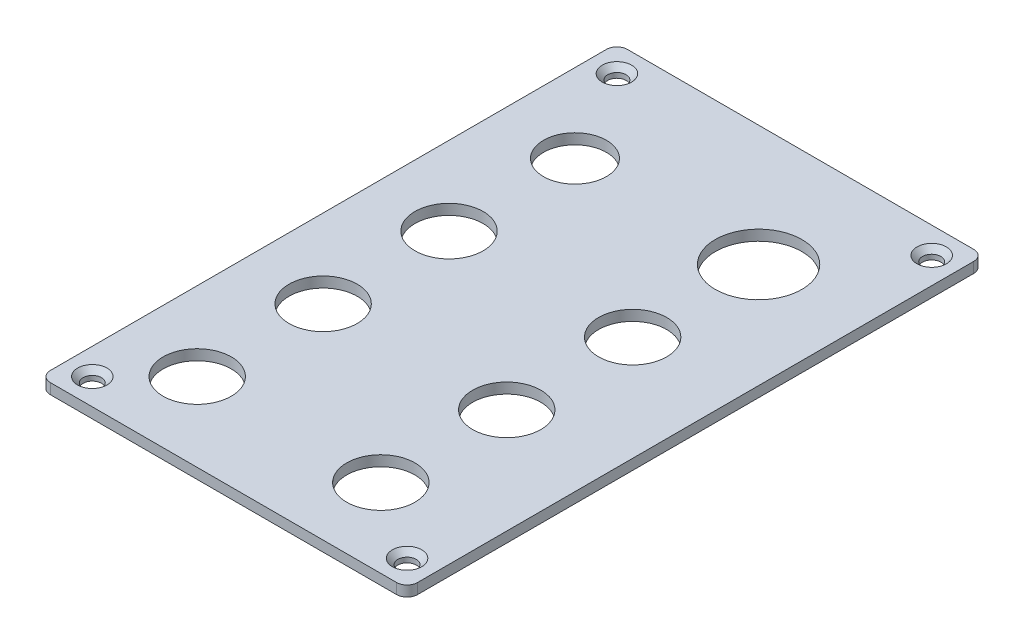
from build123d import *

# Parameters (mm, degrees)
FACE_PLATE_W           = 70
FACE_PLATE_H           = 110
FACE_PLATE_EXT_DEPTH   = 2
BUTTONS_R              = 6
BUTTONS_R_2            = 8.25
BUTTONS_R_3            = 6.5
BUTTONS_CUT_DEPTH      = 10
M3_TOP_SCREW_R         = 1.75
M3_TOP_SCREW_CUT_DEPTH = 10
FILLET1_R              = 2
FILLET2_R              = 2
FILLET3_R              = 2
FILLET4_R              = 2


with BuildPart() as part:
    # Face Plate → Face Plate Ext (new body)
    with BuildSketch(Plane(origin=(0, 0, 0), x_dir=(1, 0, 0), z_dir=(0, 1, 0))):
        Rectangle(FACE_PLATE_W, FACE_PLATE_H)
    extrude(amount=FACE_PLATE_EXT_DEPTH)

    # Buttons → Buttons CUT (cut)
    with BuildSketch(Plane(origin=(0, 2, 0), x_dir=(1, 0, 0), z_dir=(0, 1, 0))):
        with Locations((-20, 32)):
            Circle(BUTTONS_R)
        with Locations((15, 32)):
            Circle(BUTTONS_R_2)
        with Locations((-20, 8)):
            Circle(BUTTONS_R_3)
        with Locations((15, 8)):
            Circle(BUTTONS_R_3)
        with Locations((-20, -16)):
            Circle(BUTTONS_R_3)
        with Locations((-20, -40)):
            Circle(BUTTONS_R_3)
        with Locations((15, -16)):
            Circle(BUTTONS_R_3)
        with Locations((15, -40)):
            Circle(BUTTONS_R_3)
    extrude(amount=-BUTTONS_CUT_DEPTH, mode=Mode.SUBTRACT)

    # M3 Top Screw → M3 Top Screw CUT (cut)
    with BuildSketch(Plane(origin=(0, 2, 0), x_dir=(1, 0, 0), z_dir=(0, 1, 0))):
        with Locations((-30, 50)):
            Circle(M3_TOP_SCREW_R)
        with Locations((30, 50)):
            Circle(M3_TOP_SCREW_R)
        with Locations((-30, -50)):
            Circle(M3_TOP_SCREW_R)
        with Locations((30, -50)):
            Circle(M3_TOP_SCREW_R)
    extrude(amount=-M3_TOP_SCREW_CUT_DEPTH, mode=Mode.SUBTRACT)

    # M3 Head Top CUT cone 1 section (through the dimple's axis) → M3 Head Top CUT (revolve, cut)
    with BuildSketch(Plane(origin=(-30, 2, -50), x_dir=(0, 0, 1), z_dir=(1, 0, 0))):
        Polygon((0, 0), (2.8, 0), (0, 2.8), align=None)
    revolve(axis=Axis((-30, 2, -50), (0, -1, 0)), mode=Mode.SUBTRACT)

    # M3 Head Top CUT cone 2 section (through the dimple's axis) → M3 Head Top CUT cone 2 (revolve, cut)
    with BuildSketch(Plane(origin=(30, 2, -50), x_dir=(0, 0, 1), z_dir=(1, 0, 0))):
        Polygon((0, 0), (2.8, 0), (0, 2.8), align=None)
    revolve(axis=Axis((30, 2, -50), (0, -1, 0)), mode=Mode.SUBTRACT)

    # M3 Head Top CUT cone 3 section (through the dimple's axis) → M3 Head Top CUT cone 3 (revolve, cut)
    with BuildSketch(Plane(origin=(30, 2, 50), x_dir=(0, 0, 1), z_dir=(1, 0, 0))):
        Polygon((0, 0), (2.8, 0), (0, 2.8), align=None)
    revolve(axis=Axis((30, 2, 50), (0, -1, 0)), mode=Mode.SUBTRACT)

    # M3 Head Top CUT cone 4 section (through the dimple's axis) → M3 Head Top CUT cone 4 (revolve, cut)
    with BuildSketch(Plane(origin=(-30, 2, 50), x_dir=(0, 0, 1), z_dir=(1, 0, 0))):
        Polygon((0, 0), (2.8, 0), (0, 2.8), align=None)
    revolve(axis=Axis((-30, 2, 50), (0, -1, 0)), mode=Mode.SUBTRACT)

    # Fillet1
    fillet1_edges = [part.edges().sort_by_distance(p)[0] for p in [
        (-35, 1, -55),
    ]]
    fillet(fillet1_edges, radius=FILLET1_R)

    # Fillet2
    fillet2_edges = [part.edges().sort_by_distance(p)[0] for p in [
        (35, 1, -55),
    ]]
    fillet(fillet2_edges, radius=FILLET2_R)

    # Fillet3
    fillet3_edges = [part.edges().sort_by_distance(p)[0] for p in [
        (35, 1, 55),
    ]]
    fillet(fillet3_edges, radius=FILLET3_R)

    # Fillet4
    fillet4_edges = [part.edges().sort_by_distance(p)[0] for p in [
        (-35, 1, 55),
    ]]
    fillet(fillet4_edges, radius=FILLET4_R)


solid = part.part
